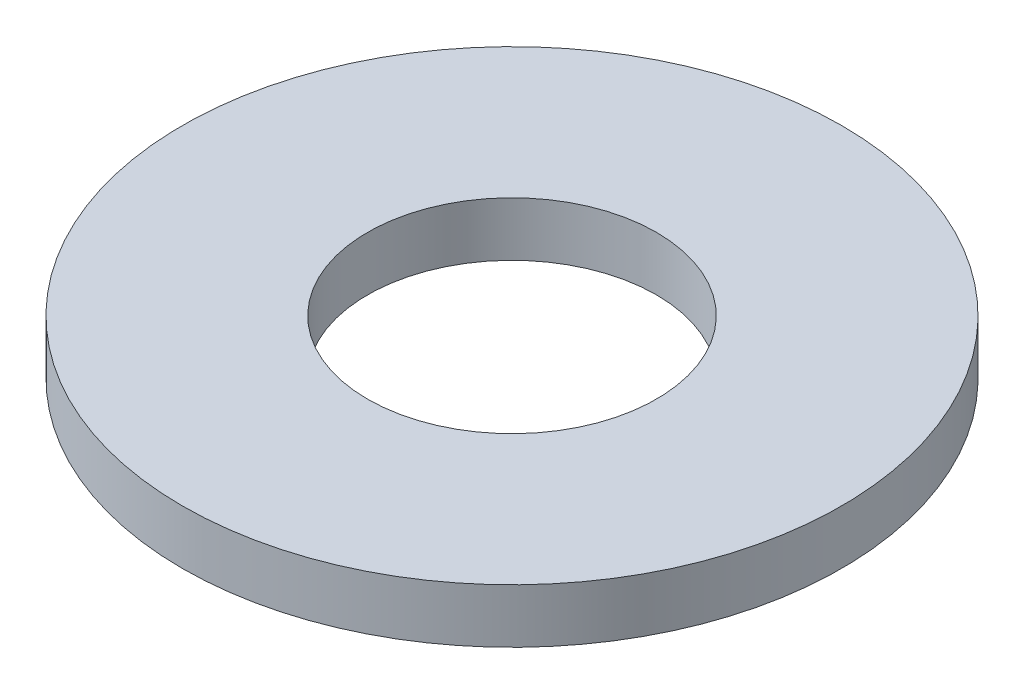
from build123d import *

# Parameters (mm, degrees)
SKETCH1_R           = 3.65
SKETCH1_R_2         = 1.6
BOSS_EXTRUDE1_DEPTH = 0.6


with BuildPart() as part:
    # Sketch1 → Boss-Extrude1 (new body)
    with BuildSketch(Plane(origin=(0, 0, 0), x_dir=(1, 0, 0), z_dir=(0, 1, 0))):
        Circle(SKETCH1_R)
        Circle(SKETCH1_R_2, mode=Mode.SUBTRACT)
    extrude(amount=BOSS_EXTRUDE1_DEPTH)


solid = part.part
